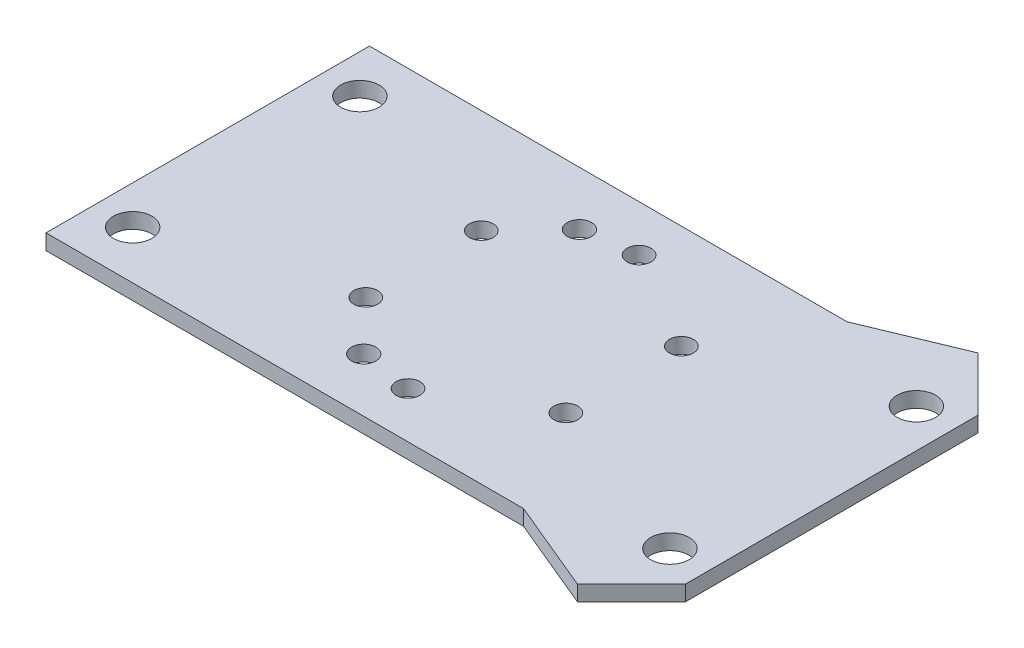
from build123d import *
from build123d.topology import SkipClean

# Parameters (mm, degrees)
SKETCH_1_R          = 25
SKETCH_1_W          = 81
SKETCH_1_H          = 42
SKETCH_1_R_2        = 2.5
EXTRUDE_1_DEPTH     = 5
SKETCH_3_W          = 8.1
SKETCH_3_H          = 6.6
SKETCH_3_R          = 1.575
CUT_EXTRUDE_1_DEPTH = 2
SKETCH_3_2_R        = 1.575
CUT_EXTRUDE_2_DEPTH = 49.280430818
SKETCH_4_W          = 8
SKETCH_4_H          = 2.9
EXTRUDE_2_DEPTH     = 42
SKETCH_1_3_R        = 2.5
CUT_EXTRUDE_3_DEPTH = 42
EXTRUDE_START       = 21
SKETCH_5_W          = 11
SKETCH_5_H          = 2.9
EXTRUDE_3_DEPTH     = 5
SKETCH_5_W_2        = 12
EXTRUDE_3_2_DEPTH   = 5
CUT_EXTRUDE_4_REACH = 87.138
CHAMFER_1_SIZE      = 2
EXTRUDE_4_DEPTH     = 15
EXTRUDE_4_2_DEPTH   = 15
EXTRUDE_START_2     = -15
EXTRUDE_5_DEPTH     = 7.9
EXTRUDE_6_DEPTH     = 15
EXTRUDE_7_DEPTH     = 7.9
FILLET_1_R          = 5
SKETCH_12_R         = 2.5
SKETCH_12_R_2       = 1.575
EXTRUDE_8_DEPTH     = 2
SKETCH_13_W         = 180
SKETCH_13_H         = 120
CUT_EXTRUDE_5_DEPTH = 51.813384064
SKETCH_14_R         = 1.55
CUT_EXTRUDE_7_DEPTH = 10


# Read off the part's stored shape, not the designer's step: 凸台-拉伸7
with BuildPart() as part:
    # 草图1 → 凸台-拉伸1 (new body)
    # profile 1 of 2: a face of its own
    with BuildSketch(Plane(origin=(0, 0, 0), x_dir=(1, 0, 0), z_dir=(0, 1, 0))):
        Circle(SKETCH_1_R)
    # profile 2 of 2: a face of its own
    with BuildSketch(Plane(origin=(0, 0, 0), x_dir=(1, 0, 0), z_dir=(0, 1, 0))):
        with Locations((-0.5, 0)):
            Rectangle(SKETCH_1_W, SKETCH_1_H)
        with Locations(Location((35, 16, 0), (0, 0, 270))):
            Circle(SKETCH_1_R_2, mode=Mode.SUBTRACT)
        with Locations(Location((35, -16, 0), (0, 0, 270))):
            Circle(SKETCH_1_R_2, mode=Mode.SUBTRACT)
        with Locations(Location((-36, 14.75, 0), (0, 0, 270))):
            Circle(SKETCH_1_R_2, mode=Mode.SUBTRACT)
        with Locations(Location((-36, -14.75, 0), (0, 0, 270))):
            Circle(SKETCH_1_R_2, mode=Mode.SUBTRACT)
    extrude(amount=EXTRUDE_1_DEPTH)

    # 草图3 → 切除-拉伸1 (cut)
    # profile 1 of 2: a face of its own
    with BuildSketch(Plane(origin=(0, 5, 0), x_dir=(1, 0, 0), z_dir=(0, 1, 0))):
        with Locations((-6.75, -14)):
            Rectangle(SKETCH_3_W, SKETCH_3_H)
        with Locations(Location((-6.75, -14, 0), (0, 0, 90))):
            Circle(SKETCH_3_R, mode=Mode.SUBTRACT)
    # profile 2 of 2: a face of its own
    with BuildSketch(Plane(origin=(0, 5, 0), x_dir=(1, 0, 0), z_dir=(0, 1, 0))):
        with Locations((-6.75, 14)):
            Rectangle(SKETCH_3_W, SKETCH_3_H)
        with Locations(Location((-6.75, 14, 0), (0, 0, 270))):
            Circle(SKETCH_3_R, mode=Mode.SUBTRACT)
    extrude(amount=-CUT_EXTRUDE_1_DEPTH, mode=Mode.SUBTRACT)

    # 草图3<2> → 切除-拉伸2 (cut, through all)
    with BuildSketch(Plane(origin=(0, 5, 0), x_dir=(1, 0, 0), z_dir=(0, 1, 0))):
        with Locations(Location((-6.75, 14, 0), (0, 0, 270))):
            Circle(SKETCH_3_2_R)
        with Locations(Location((-6.75, -14, 0), (0, 0, 270))):
            Circle(SKETCH_3_2_R)
    extrude(amount=-CUT_EXTRUDE_2_DEPTH, mode=Mode.SUBTRACT)

    # 草图4 → 凸台-拉伸2 (add)
    with BuildSketch(Plane.XY.offset(21)):
        with Locations((36, 6.45)):
            Rectangle(SKETCH_4_W, SKETCH_4_H)
        with Locations((-37, 6.45)):
            Rectangle(SKETCH_4_W, SKETCH_4_H)
    extrude(amount=-EXTRUDE_2_DEPTH)

    # 草图1<3> → 切除-拉伸3 (cut)
    with BuildSketch(Plane(origin=(0, 0, 0), x_dir=(1, 0, 0), z_dir=(0, 1, 0))):
        with Locations(Location((35, 16, 0), (0, 0, 270))):
            Circle(SKETCH_1_3_R)
        with Locations(Location((35, -16, 0), (0, 0, 270))):
            Circle(SKETCH_1_3_R)
        with Locations(Location((-36, 14.75, 0), (0, 0, 180))):
            Circle(SKETCH_1_3_R)
        with Locations(Location((-36, -14.75, 0), (0, 0, 180))):
            Circle(SKETCH_1_3_R)
    extrude(amount=CUT_EXTRUDE_3_DEPTH, mode=Mode.SUBTRACT)


with BuildPart() as body_2:
    # 草图5 → 凸台-拉伸3 (new body)
    with BuildSketch(Plane.XY.offset(EXTRUDE_START)):
        with Locations((26.5, 6.45)):
            Rectangle(SKETCH_5_W, SKETCH_5_H)
    extrude_3 = extrude(amount=-EXTRUDE_3_DEPTH)


with BuildPart() as body_3:
    # 草图5 → Extrude 3 2 (new body)
    with BuildSketch(Plane.XY.offset(EXTRUDE_START)):
        with Locations((-27, 6.45)):
            Rectangle(SKETCH_5_W_2, SKETCH_5_H)
    extrude_3_2 = extrude(amount=-EXTRUDE_3_2_DEPTH)



with BuildPart() as part_1:
    add(part.part)

    # 镜向2: 凸台-拉伸3, Extrude 3 2 across plane
    add(extrude_3.mirror(Plane(origin=(0, 0, 0), x_dir=(1, 0, 0), z_dir=(0, 0, -1))))
    add(extrude_3_2.mirror(Plane(origin=(0, 0, 0), x_dir=(1, 0, 0), z_dir=(0, 0, -1))))

    # 切除-拉伸4: up to this face of the body (flat: up to its plane)
    cut_extrude_4_end = Plane(part_1.part.faces().sort_by_distance((32, 6.45, 2.5))[0])
    # 草图6 → 切除-拉伸4 (cut, up to the picked face)
    with BuildSketch(Plane.ZY.offset(41), mode=Mode.PRIVATE) as cut_extrude_4_sk1:
        with BuildLine():
            Line((11.041960784, 8.971428571), (-11.041960784, 8.971428571))
            ThreePointArc((-11.041960784, 8.971428571), (-8.690257734, 7.239234925), (-6.072727273, 5.943265655))
            ThreePointArc((-6.072727273, 5.943265655), (0, 4.8), (6.072727273, 5.943265655))
            ThreePointArc((6.072727273, 5.943265655), (8.690257734, 7.239234925), (11.041960784, 8.971428571))
        make_face()
    cut_extrude_4_tool1 = split(extrude(cut_extrude_4_sk1.sketch, amount=-CUT_EXTRUDE_4_REACH, mode=Mode.PRIVATE), bisect_by=cut_extrude_4_end, keep=Keep.BOTH, mode=Mode.PRIVATE)
    add(cut_extrude_4_tool1.solids().sort_by(Axis((-41, 7.283597, 0), (1, 0, 0)))[0], mode=Mode.SUBTRACT)

    # 倒角1
    chamfer_1_edges = [part_1.edges().sort_by_distance(p)[0] for p in [
        (-41, 3.95, 21),
        (-41, 3.95, -21),
        (40, 3.95, -21),
        (40, 3.95, 21),
    ]]
    chamfer(chamfer_1_edges, length=CHAMFER_1_SIZE)



with BuildPart() as body_4:
    # 草图9 → 凸台-拉伸4 (new body)
    with BuildSketch(Plane.XZ):
        with BuildLine():
            Line((33, 26), (23.72846392, 26))
            ThreePointArc((23.72846392, 26), (24.88485791, 24.895458357), (25.989891949, 23.739534884))
            ThreePointArc((25.989891949, 23.739534884), (27.687521221, 22.340851231), (29.708138181, 21.471732017))
            ThreePointArc((29.708138181, 21.471732017), (30.719571772, 21.268231436), (31.749015733, 21.2))
            Line((31.749015733, 21.2), (37.8, 21.2))
            Line((37.8, 21.2), (33, 26))
        make_face()
    extrude(amount=-EXTRUDE_4_DEPTH)


with BuildPart() as body_5:
    # 草图9 → Extrude 4 2 (new body)
    with BuildSketch(Plane.XZ):
        with BuildLine():
            Line((33, -26), (37.8, -21.2))
            Line((37.8, -21.2), (31.749015733, -21.2))
            ThreePointArc((31.749015733, -21.2), (30.719571772, -21.268231436), (29.708138181, -21.471732017))
            ThreePointArc((29.708138181, -21.471732017), (27.687521221, -22.340851231), (25.989891949, -23.739534884))
            ThreePointArc((25.989891949, -23.739534884), (24.88485791, -24.895458357), (23.72846392, -26))
            Line((23.72846392, -26), (33, -26))
        make_face()
    extrude(amount=-EXTRUDE_4_2_DEPTH)


with BuildPart() as part_2:
    add(part_1.part)

    add(body_4.part)  # 凸台-拉伸5 merges body 4
    # 草图10 → 凸台-拉伸5 (add)
    with BuildSketch(Plane(origin=(0, 15, 0), x_dir=(1, 0, 0), z_dir=(0, 1, 0)).offset(EXTRUDE_START_2)):
        with BuildLine():
            Line((21, -21), (23.72846392, -26))
            ThreePointArc((23.72846392, -26), (24.88485791, -24.895458357), (25.989891949, -23.739534884))
            ThreePointArc((25.989891949, -23.739534884), (28.601924052, -21.863066908), (31.749015733, -21.2))
            Line((31.749015733, -21.2), (37.8, -21.2))
            Line((37.8, -21.2), (38, -21))
            Line((38, -21), (32, -21))
            Line((32, -21), (21, -21))
        make_face()
    extrude_5 = extrude(amount=EXTRUDE_5_DEPTH)


with BuildPart() as body_3_1:
    add(body_3.part)

    add(part_2.part)  # 凸台-拉伸6 merges part
    # 草图11 → 凸台-拉伸6 (add)
    with BuildSketch(Plane.XZ.offset(EXTRUDE_START_2)):
        with BuildLine():
            Line((-41, 23), (-41, 20.45))
            Line((-41, 20.45), (-40.520827978, 20.45))
            ThreePointArc((-40.520827978, 20.45), (-40.024975712, 20.455165886), (-39.5293387, 20.4706613))
            Line((-39.5293387, 20.4706613), (-39, 21))
            Line((-39, 21), (-35.43383476, 21))
            ThreePointArc((-35.43383476, 21), (-31.171725667, 22.363148102), (-27.240108871, 24.5))
            Line((-27.240108871, 24.5), (-41, 24.5))
            Line((-41, 24.5), (-41, 23))
        make_face()
        with BuildLine():
            Line((-39, 21), (-39.5293387, 20.4706613))
            ThreePointArc((-39.5293387, 20.4706613), (-39.301113021, 20.481274846), (-39.072999743, 20.494078772))
            ThreePointArc((-39.072999743, 20.494078772), (-38.358018151, 20.54847571), (-37.644999743, 20.624386527))
            ThreePointArc((-37.644999743, 20.624386527), (-36.534990206, 20.786132091), (-35.43383476, 21))
            Line((-35.43383476, 21), (-39, 21))
        make_face()
    extrude_6 = extrude(amount=EXTRUDE_6_DEPTH)

    # 凸台-拉伸7 outline → 凸台-拉伸7 (add)
    with BuildSketch(Plane(origin=(0, 0, 0), x_dir=(1, 0, 0), z_dir=(0, 1, 0))):
        with BuildLine():
            Line((-39.5293387, -20.4706613), (-41, -19))
            Line((-41, -19), (-41, -20.45))
            Line((-41, -20.45), (-40.520827978, -20.45))
            ThreePointArc((-40.520827978, -20.45), (-40.024975712, -20.455165886), (-39.5293387, -20.4706613))
        make_face()
        with BuildLine():
            Line((-21, -21), (-35.43383476, -21))
            ThreePointArc((-35.43383476, -21), (-31.171725667, -22.363148102), (-27.240108871, -24.5))
            Line((-27.240108871, -24.5), (-21, -21))
        make_face()
    extrude_7 = extrude(amount=EXTRUDE_7_DEPTH)

    # 镜向3: 凸台-拉伸5, 凸台-拉伸6, 凸台-拉伸7 across plane
    add(extrude_5.mirror(Plane(origin=(0, 0, 0), x_dir=(1, 0, 0), z_dir=(0, 0, -1))))
    add(extrude_6.mirror(Plane(origin=(0, 0, 0), x_dir=(1, 0, 0), z_dir=(0, 0, -1))))
    add(extrude_7.mirror(Plane(origin=(0, 0, 0), x_dir=(1, 0, 0), z_dir=(0, 0, -1))))


with BuildPart() as body_2_1:
    add(body_2.part)

    # Combine 1: union body 3, body 5
    add(body_3_1.part)
    add(body_5.part)

    # 圆角1
    fillet_1_edges = [body_2_1.edges().sort_by_distance(p)[0] for p in [
        (32, 6.45, 16),
        (-33, 6.45, 16),
        (-33, 6.45, -16),
        (32, 6.45, -16),
    ]]
    fillet(fillet_1_edges, radius=FILLET_1_R)

    # 草图12 → 凸台-拉伸8 (add)
    with SkipClean():  # the faces are left unmerged after this step: merging them gives an invalid solid
        with BuildSketch(Plane.XZ):
            Polygon((13.564659966, 21), (-13.564659966, 21), (-21, 21), (-41, 21), (-41, -21), (-21, -21), (-13.564659966, -21), (13.564659966, -21), (21, -21), (33, -26), (40, -19), (40, 19), (33, 26), (21, 21), align=None)
            with Locations((-36, -14.75)):
                Circle(SKETCH_12_R, mode=Mode.SUBTRACT)
            with Locations((-6.75, -14)):
                Circle(SKETCH_12_R_2, mode=Mode.SUBTRACT)
            with Locations((35, -16)):
                Circle(SKETCH_12_R, mode=Mode.SUBTRACT)
            with Locations((-36, 14.75)):
                Circle(SKETCH_12_R, mode=Mode.SUBTRACT)
            with Locations((-6.75, 14)):
                Circle(SKETCH_12_R_2, mode=Mode.SUBTRACT)
            with Locations((35, 16)):
                Circle(SKETCH_12_R, mode=Mode.SUBTRACT)
        extrude(amount=EXTRUDE_8_DEPTH)

    # 草图13 → 切除-拉伸5 (cut, through all)
    with BuildSketch(Plane.XZ):
        with Locations((-41, 24.5)):
            Rectangle(SKETCH_13_W, SKETCH_13_H)
    extrude(amount=-CUT_EXTRUDE_5_DEPTH, mode=Mode.SUBTRACT)

    # 草图14 → 切除-拉伸7 (cut)
    with BuildSketch(Plane.XZ):
        with Locations(Location((12.990381057, 7.5, 0), (0, 0, 270))):
            Circle(SKETCH_14_R)
        with Locations(Location((12.990381057, -7.5, 0), (0, 0, 270))):
            Circle(SKETCH_14_R)
        with Locations(Location((0, -15, 0), (0, 0, 270))):
            Circle(SKETCH_14_R)
        with Locations(Location((-12.990381057, -7.5, 0), (0, 0, 270))):
            Circle(SKETCH_14_R)
        with Locations(Location((-12.990381057, 7.5, 0), (0, 0, 270))):
            Circle(SKETCH_14_R)
        with Locations(Location((0, 15, 0), (0, 0, 270))):
            Circle(SKETCH_14_R)
    extrude(amount=CUT_EXTRUDE_7_DEPTH, mode=Mode.SUBTRACT)


solid = body_2_1.part
